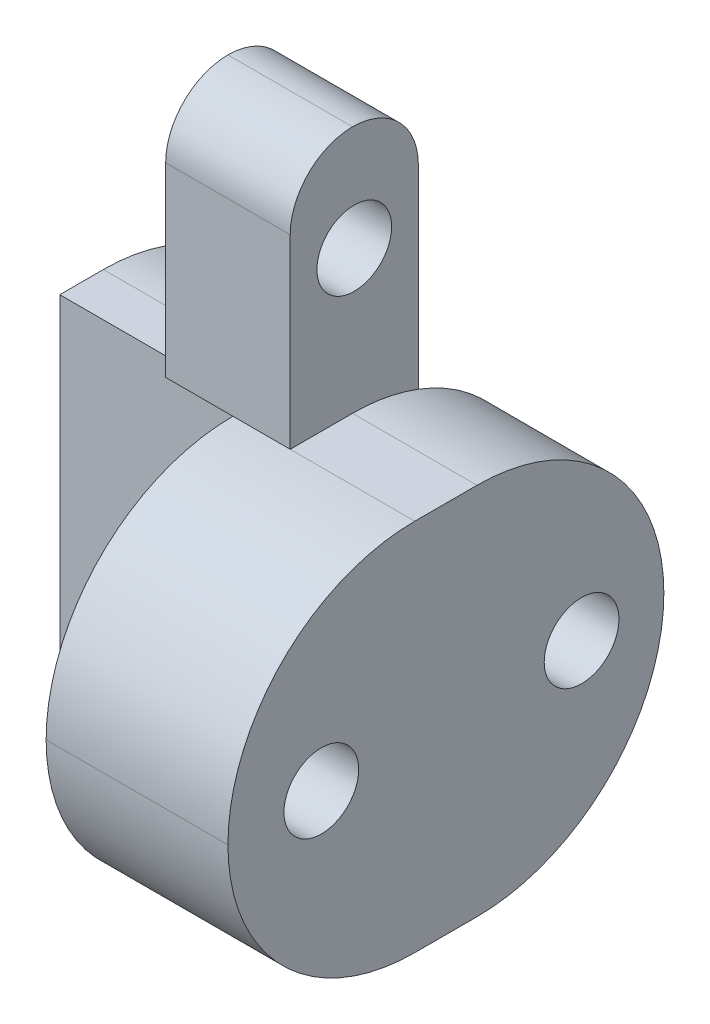
from build123d import *

# Parameters (mm, degrees)
BOSS_EXTRUDE2_DEPTH     = 30
SKETCH3_R               = 3
CUT_EXTRUDE1_DEPTH      = 30
FILLET7_R               = 15
FILLET8_R               = 15
CUT_EXTRUDE2_DEPTH      = 30
CUT_EXTRUDE2_DEPTH_BACK = 30
SKETCH6_R               = 3
SKETCH7_W               = 10
SKETCH7_H               = 10.288497565
BOSS_EXTRUDE3_DEPTH     = 19.923787886
SKETCH8_R               = 3
CUT_EXTRUDE3_DEPTH      = 10
FILLET12_R              = 5
FILLET15_R              = 5.3
FILLET17_R              = 15
SKETCH9_W               = 1.5
SKETCH9_H               = 30
CUT_EXTRUDE4_DEPTH      = 15.39622199


# Some blends are built 0.0001 mm under size
with BuildPart() as part:
    # Sketch2 → Boss-Extrude2 (new body)
    with BuildSketch(Plane(origin=(0, 0, 0), x_dir=(1, 0, 0), z_dir=(0, 1, 0))):
        Polygon((0, 0), (14.595501533, 0), (14.595501533, 35), (4.595501533, 35), (4.595501533, 25.288497565), (-5.404498467, 25.288497565), (-5.404498467, 35), (-15.404498467, 35), (-15.404498467, 15), (0, 15), align=None)
    extrude(amount=BOSS_EXTRUDE2_DEPTH)

    # Sketch3 → Cut-Extrude1 (cut)
    with BuildSketch(Plane.ZY):
        with Locations((-7.5, 15)):
            Circle(SKETCH3_R)
    extrude(amount=-CUT_EXTRUDE1_DEPTH, mode=Mode.SUBTRACT)

    # Fillet7
    fillet7_edges = [part.edges().sort_by_distance(p)[0] for p in [
        (7.297750767, 30, 0),
    ]]
    fillet(fillet7_edges, radius=FILLET7_R)

    # Fillet8
    fillet8_edges = [part.edges().sort_by_distance(p)[0] for p in [
        (7.297750767, 0, 0),
    ]]
    fillet(fillet8_edges, radius=FILLET8_R - 0.0001)  # a hair under: the kernel refuses the full size

    # Sketch6 → Cut-Extrude2 (cut, two sides: drawn at the far end of the back side and taken through both)
    with BuildSketch(Plane.ZY.offset(-4.595501533).offset(-CUT_EXTRUDE2_DEPTH_BACK)):
        with Locations(Location((-28.393945452, 15, 0), (0, 0, 180))):
            Circle(SKETCH6_R)
    extrude(amount=CUT_EXTRUDE2_DEPTH + CUT_EXTRUDE2_DEPTH_BACK, mode=Mode.SUBTRACT)

    # Sketch7 → Boss-Extrude3 (add)
    with BuildSketch(Plane(origin=(0, 30, 0), x_dir=(1, 0, 0), z_dir=(0, 1, 0))):
        with Locations((-0.404498467, 20.144248783)):
            Rectangle(SKETCH7_W, SKETCH7_H)
    extrude(amount=BOSS_EXTRUDE3_DEPTH)

    # Sketch8 → Cut-Extrude3 (cut)
    with BuildSketch(Plane(origin=(4.595501533, 0, 0), x_dir=(0, 0, -1), z_dir=(1, 0, 0))):
        with Locations((20.144248782, 41.414541631)):
            Circle(SKETCH8_R)
    extrude(amount=-CUT_EXTRUDE3_DEPTH, mode=Mode.SUBTRACT)

    # Fillet12
    fillet12_edges = [part.edges().sort_by_distance(p)[0] for p in [
        (-0.404498467, 49.923787886, -15),
    ]]
    fillet(fillet12_edges, radius=FILLET12_R)

    # Fillet15
    # the kernel refuses this fillet: 5.3 mm, written as the material it takes off along each edge
    with BuildSketch(Plane(origin=(17.845501533, 49.923787886, -25.288497565), x_dir=(0, 0, 1), z_dir=(-1, 0, 0))) as fillet15_piece_1:
        with BuildLine():
            CenterArc((FILLET15_R, -FILLET15_R), FILLET15_R, 90, 90)
            Line((0, -FILLET15_R), (-FILLET15_R * 0.02, -FILLET15_R))
            Line((-FILLET15_R * 0.02, -FILLET15_R), (-FILLET15_R * 0.02, FILLET15_R * 0.02))
            Line((-FILLET15_R * 0.02, FILLET15_R * 0.02), (FILLET15_R, FILLET15_R * 0.02))
            Line((FILLET15_R, FILLET15_R * 0.02), (FILLET15_R, 0))
        make_face()
    extrude(amount=36.5, mode=Mode.SUBTRACT)

    # Fillet17
    # the kernel refuses this fillet: 15 mm, written as the material it takes off along each edge
    with BuildSketch(Plane(origin=(52.095501533, 30, -35), x_dir=(0, 0, 1), z_dir=(-1, 0, 0)), Plane(origin=(-5.404498467, 30, -35), x_dir=(0, 0, 1), z_dir=(-1, 0, 0))) as fillet17_piece_1:
        with BuildLine():
            CenterArc((FILLET17_R, -FILLET17_R), FILLET17_R, 90, 90)
            Line((0, -FILLET17_R), (0, 0))
            Line((0, 0), (FILLET17_R, 0))
        make_face()
    extrude(amount=47.5, mode=Mode.SUBTRACT)
    with BuildSketch(Plane(origin=(52.095501533, 30, -35), x_dir=(0, 0, 1), z_dir=(-1, 0, 0))) as fillet17_piece_2_section:
        with BuildLine():
            CenterArc((FILLET17_R, -FILLET17_R), FILLET17_R, 90, 90)
            Line((0, -FILLET17_R), (0, 0))
            Line((0, 0), (FILLET17_R, 0))
        make_face()
    fillet17_piece_2 = extrude(amount=85, mode=Mode.PRIVATE)
    fillet17_piece_2 = split(fillet17_piece_2, bisect_by=Plane(origin=(-5.404498467, 29.712703536, -23.975011992), z_dir=(-1, 0, 0)), keep=Keep.TOP, mode=Mode.PRIVATE)
    add(fillet17_piece_2, mode=Mode.SUBTRACT)
    with BuildSketch(Plane(origin=(32.095501533, 0, -35), x_dir=(0, 0, 1), z_dir=(-1, 0, 0))) as fillet17_piece_3:
        with BuildLine():
            CenterArc((FILLET17_R, FILLET17_R), FILLET17_R, 180, 90)
            Line((0, FILLET17_R), (0, 0))
            Line((0, 0), (FILLET17_R, 0))
        make_face()
    extrude(amount=85, mode=Mode.SUBTRACT)
    with BuildSketch(Plane(origin=(32.095501533, 30, -35), x_dir=(0, 0, 1), z_dir=(-1, 0, 0))) as fillet17_piece_4_section:
        with BuildLine():
            CenterArc((FILLET17_R, -FILLET17_R), FILLET17_R, 90, 90)
            Line((0, -FILLET17_R), (0, 0))
            Line((0, 0), (FILLET17_R, 0))
        make_face()
    fillet17_piece_4 = extrude(amount=85, mode=Mode.PRIVATE)
    fillet17_piece_4 = split(fillet17_piece_4, bisect_by=Plane(origin=(4.595501533, 29.712703536, -23.975011992), z_dir=(1, 0, 0)), keep=Keep.TOP, mode=Mode.PRIVATE)
    add(fillet17_piece_4, mode=Mode.SUBTRACT)

    # Sketch9 → Cut-Extrude4 (cut)
    with BuildSketch(Plane.ZY.offset(15.404498467)):
        with Locations((-15.75, 15)):
            Rectangle(SKETCH9_W, SKETCH9_H)
    extrude(amount=-CUT_EXTRUDE4_DEPTH, mode=Mode.SUBTRACT)


solid = part.part
